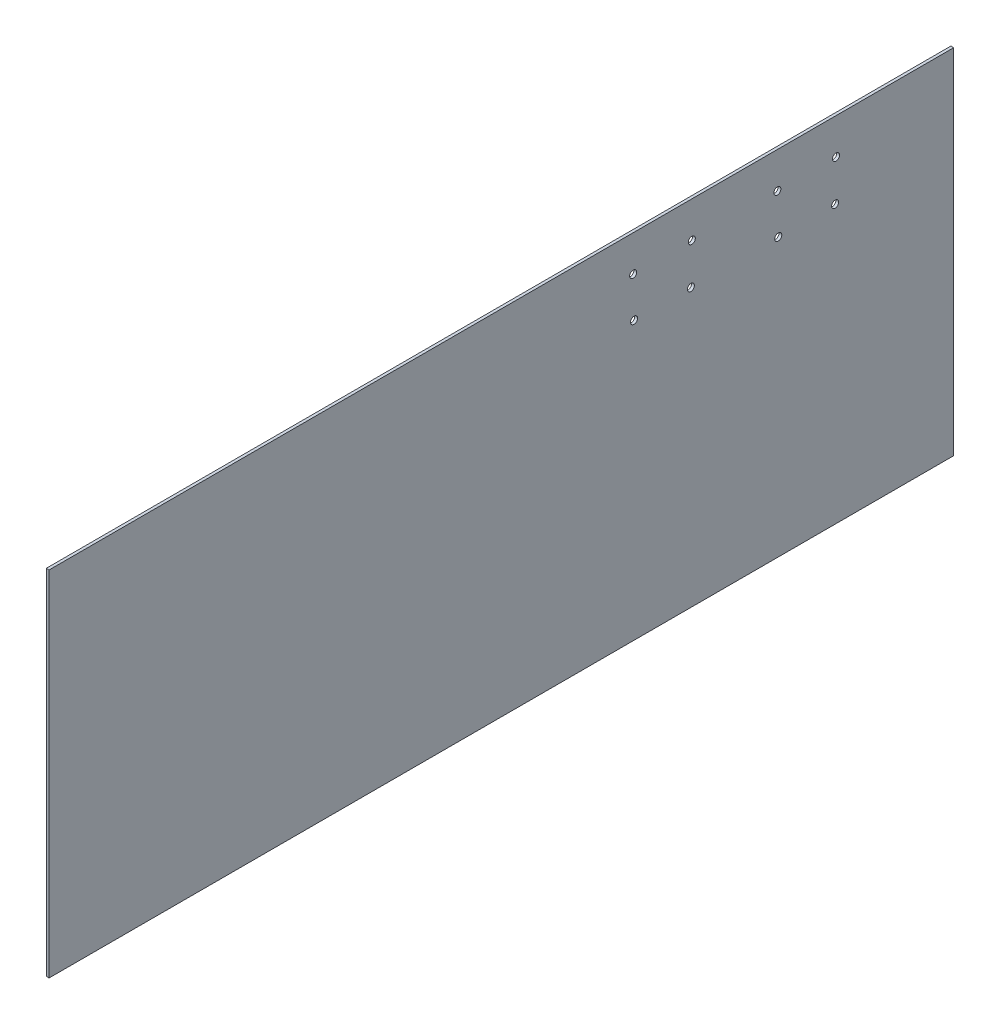
from build123d import *

# Parameters (mm, degrees)
SKETCH1_W           = 640
SKETCH1_H           = 250
SKETCH1_R           = 2.5
BOSS_EXTRUDE1_DEPTH = 2


with BuildPart() as part:
    # Sketch1 → Boss-Extrude1 (new body)
    with BuildSketch(Plane(origin=(0, 0, 0), x_dir=(0, 0, -1), z_dir=(1, 0, 0))):
        with Locations((1.245136187, 10.719844358)):
            Rectangle(SKETCH1_W, SKETCH1_H)
        with Locations((94.445299551, 110.318214684)):
            Circle(SKETCH1_R, mode=Mode.SUBTRACT)
        with Locations((135.936334167, 110.318214684)):
            Circle(SKETCH1_R, mode=Mode.SUBTRACT)
        with Locations((95.072818436, 81.778214684)):
            Circle(SKETCH1_R, mode=Mode.SUBTRACT)
        with Locations((135.289472124, 81.778214684)):
            Circle(SKETCH1_R, mode=Mode.SUBTRACT)
        with Locations((196.472331012, 110.318214684)):
            Circle(SKETCH1_R, mode=Mode.SUBTRACT)
        with Locations((197.099849897, 81.778214684)):
            Circle(SKETCH1_R, mode=Mode.SUBTRACT)
        with Locations((237.316503585, 81.778214684)):
            Circle(SKETCH1_R, mode=Mode.SUBTRACT)
        with Locations((237.963365628, 110.318214684)):
            Circle(SKETCH1_R, mode=Mode.SUBTRACT)
    extrude(amount=BOSS_EXTRUDE1_DEPTH)


solid = part.part
